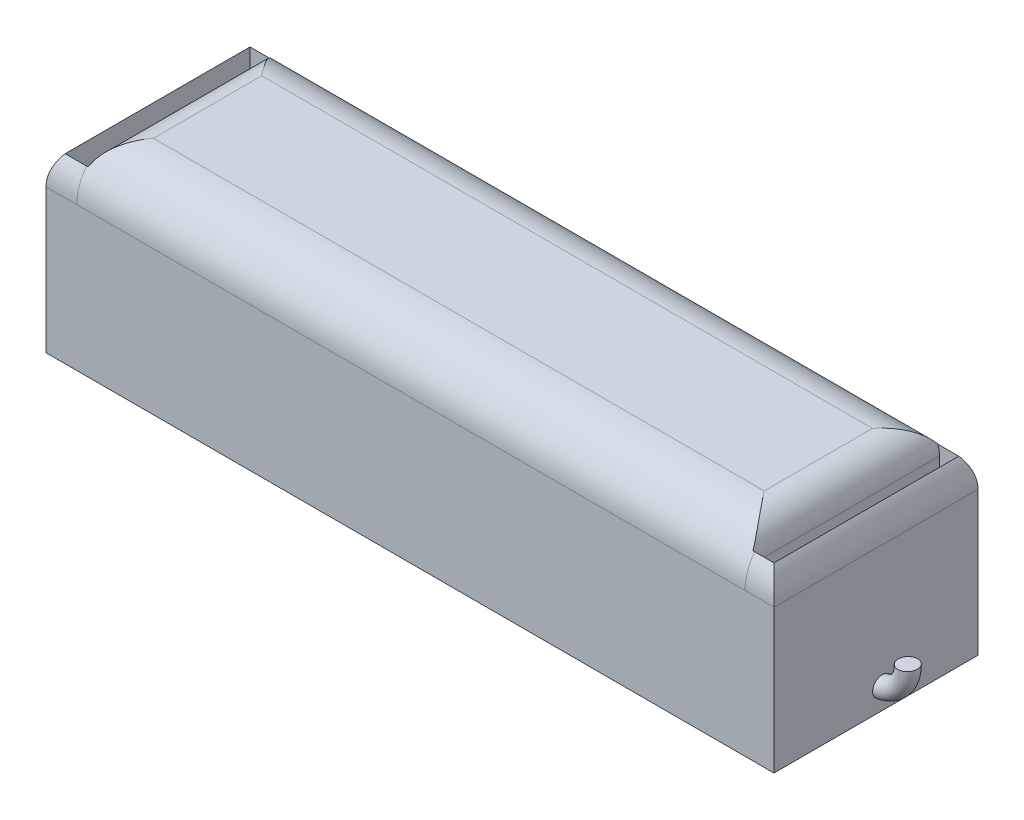
from build123d import *

# Parameters (mm, degrees)
SKETCH_1_W        = 76
SKETCH_1_H        = 21.3
EXTRUDE_1_DEPTH   = 20
SHELL_1_T         = -1
FILLET_1_R        = 5
SWEEP_6_PROFILE_R = 1
SKETCH_31_W       = 69.763625698
SKETCH_31_H       = 21.3
EXTRUDE_2_DEPTH   = 20
FILLET_2_R        = 5
FILLET_3_R        = 3


# Some blends are built 0.0001 mm under size
with BuildPart() as part:
    # 草图1 → 凸台-拉伸1 (new body)
    with BuildSketch(Plane(origin=(0, 0, 0), x_dir=(1, 0, 0), z_dir=(0, 1, 0))):
        Rectangle(SKETCH_1_W, SKETCH_1_H)
    extrude(amount=EXTRUDE_1_DEPTH)

    # 抽壳1
    shell_1_openings = [part.faces().sort_by_distance(p)[0] for p in [
        (0, 20, 0),
    ]]
    offset(amount=SHELL_1_T, openings=shell_1_openings, kind=Kind.INTERSECTION)

    # 圆角1
    # the kernel refuses this fillet: 5 mm, written as the material it takes off along each edge
    with BuildSketch(Plane(origin=(50.5, 20, 10.65), x_dir=(0, -1, 0), z_dir=(-1, 0, 0)), Plane(origin=(-50.5, 20, -10.65), x_dir=(0, -1, 0), z_dir=(1, 0, 0))) as fillet_1_piece_1:
        with BuildLine():
            CenterArc((FILLET_1_R, -FILLET_1_R), FILLET_1_R, 90, 90)
            Line((0, -FILLET_1_R), (0, 0))
            Line((0, 0), (FILLET_1_R, 0))
        make_face()
    extrude(amount=101, mode=Mode.SUBTRACT)
    with BuildSketch(Plane(origin=(-38, 20, 23.15), x_dir=(0, -1, 0), z_dir=(0, 0, -1)), Plane(origin=(38, 20, -23.15), x_dir=(0, -1, 0), z_dir=(0, 0, 1))) as fillet_1_piece_2:
        with BuildLine():
            CenterArc((FILLET_1_R, -FILLET_1_R), FILLET_1_R, 90, 90)
            Line((0, -FILLET_1_R), (0, 0))
            Line((0, 0), (FILLET_1_R, 0))
        make_face()
    extrude(amount=46.3, mode=Mode.SUBTRACT)

    # 扫描6: sweep along a path in 草图28
    with BuildLine(Plane(origin=(0, 0, -0.65), x_dir=(-1, 0, 0), z_dir=(0, 0, -1))) as sweep_6_path:
        ThreePointArc((-36.233593207, 2.382632109), (-39.300833377, 2.764708579), (-40.66674233, 5.537475685))
    # 扫描6 profile (on start of the path) → 扫描6 (sweep)
    with BuildSketch(Plane(origin=(36.233593207, 2.382632109, -0.65), x_dir=(0.3622157800596906, 0.9320942702729965, 0), z_dir=(0.9320942702729965, -0.3622157800596906, 0))):
        Circle(SWEEP_6_PROFILE_R)
    sweep_6 = sweep(path=sweep_6_path.line)

    # 镜向1: 扫描6 across plane
    add(sweep_6.mirror(Plane(origin=(0, 0, 0), x_dir=(0, 0, 1), z_dir=(1, 0, 0))))

    # 草图31 → 凸台-拉伸2 (add)
    with BuildSketch(Plane.XZ):
        with Locations((0.098872665, 0)):
            Rectangle(SKETCH_31_W, SKETCH_31_H)
    extrude(amount=-EXTRUDE_2_DEPTH)

    # 圆角2
    fillet_2_edges = [part.edges().sort_by_distance(p)[0] for p in [
        (0.098872665, 20, 10.65),
        (0.098872665, 20, -10.65),
    ]]
    fillet(fillet_2_edges, radius=FILLET_2_R - 0.0001)  # a hair under: the kernel refuses the full size

    # 圆角3
    # the kernel refuses this fillet: 3 mm, written as the material it takes off along each edge
    with BuildSketch(Plane(origin=(-34.782940184, 20, -13.1501), x_dir=(0, -1, 0), z_dir=(0, 0, 1))) as fillet_3_piece_1_section:
        with BuildLine():
            CenterArc((FILLET_3_R, FILLET_3_R), FILLET_3_R, 180, 90)
            Line((0, FILLET_3_R), (0, 0))
            Line((0, 0), (FILLET_3_R, 0))
        make_face()
    fillet_3_piece_1 = extrude(amount=26.3002, mode=Mode.PRIVATE)
    fillet_3_piece_1 = fillet_3_piece_1 - Plane(origin=(-34.754340775, 15, -5.65), x_dir=(0, -1, 0), z_dir=(-1, 0, 0)) * Cylinder(5, 65, mode=Mode.PRIVATE)
    fillet_3_piece_1 = split(fillet_3_piece_1, bisect_by=Plane(origin=(-34.754340775, 17.516941368, 9.65), z_dir=(0, 0, -1)), keep=Keep.TOP, mode=Mode.PRIVATE)
    with BuildSketch(Plane(origin=(-34.782940184, 20, -13.1501), x_dir=(0, -1, 0), z_dir=(0, 0, 1))) as fillet_3_piece_2_section:
        with BuildLine():
            CenterArc((FILLET_3_R, FILLET_3_R), FILLET_3_R, 180, 90)
            Line((0, FILLET_3_R), (0, 0))
            Line((0, 0), (FILLET_3_R, 0))
        make_face()
    fillet_3_piece_2 = extrude(amount=26.3002, mode=Mode.PRIVATE)
    fillet_3_piece_2 = fillet_3_piece_2 - Plane(origin=(-34.270709836, 15, 5.65), x_dir=(0, -1, 0), z_dir=(1, 0, 0)) * Cylinder(5, 65, mode=Mode.PRIVATE)
    fillet_3_piece_2 = split(fillet_3_piece_2, bisect_by=Plane(origin=(-34.270709836, 19.090975867, -9.65), z_dir=(0, 0, 1)), keep=Keep.TOP, mode=Mode.PRIVATE)
    with BuildSketch(Plane(origin=(34.980685514, 20, 13.1501), x_dir=(0, -1, 0), z_dir=(0, 0, -1))) as fillet_3_piece_3_section:
        with BuildLine():
            CenterArc((FILLET_3_R, FILLET_3_R), FILLET_3_R, 180, 90)
            Line((0, FILLET_3_R), (0, 0))
            Line((0, 0), (FILLET_3_R, 0))
        make_face()
    fillet_3_piece_3 = extrude(amount=26.3002, mode=Mode.PRIVATE)
    fillet_3_piece_3 = split(fillet_3_piece_3, bisect_by=Plane(origin=(34.952086105, 17.516941368, -9.65), z_dir=(0, 0, 1)), keep=Keep.TOP, mode=Mode.PRIVATE)
    fillet_3_piece_3 = fillet_3_piece_3 - Plane(origin=(34.952086105, 15, 5.65), x_dir=(0, -1, 0), z_dir=(1, 0, 0)) * Cylinder(5, 65, mode=Mode.PRIVATE)
    with BuildSketch(Plane(origin=(34.980685514, 20, 13.1501), x_dir=(0, -1, 0), z_dir=(0, 0, -1))) as fillet_3_piece_4_section:
        with BuildLine():
            CenterArc((FILLET_3_R, FILLET_3_R), FILLET_3_R, 180, 90)
            Line((0, FILLET_3_R), (0, 0))
            Line((0, 0), (FILLET_3_R, 0))
        make_face()
    fillet_3_piece_4 = extrude(amount=26.3002, mode=Mode.PRIVATE)
    fillet_3_piece_4 = fillet_3_piece_4 - Plane(origin=(34.468455166, 15, -5.65), x_dir=(0, -1, 0), z_dir=(-1, 0, 0)) * Cylinder(5, 65, mode=Mode.PRIVATE)
    fillet_3_piece_4 = split(fillet_3_piece_4, bisect_by=Plane(origin=(34.468455166, 19.090975867, 9.65), z_dir=(0, 0, -1)), keep=Keep.TOP, mode=Mode.PRIVATE)
    add([fillet_3_piece_1, fillet_3_piece_2, fillet_3_piece_3, fillet_3_piece_4], mode=Mode.SUBTRACT)


solid = part.part
